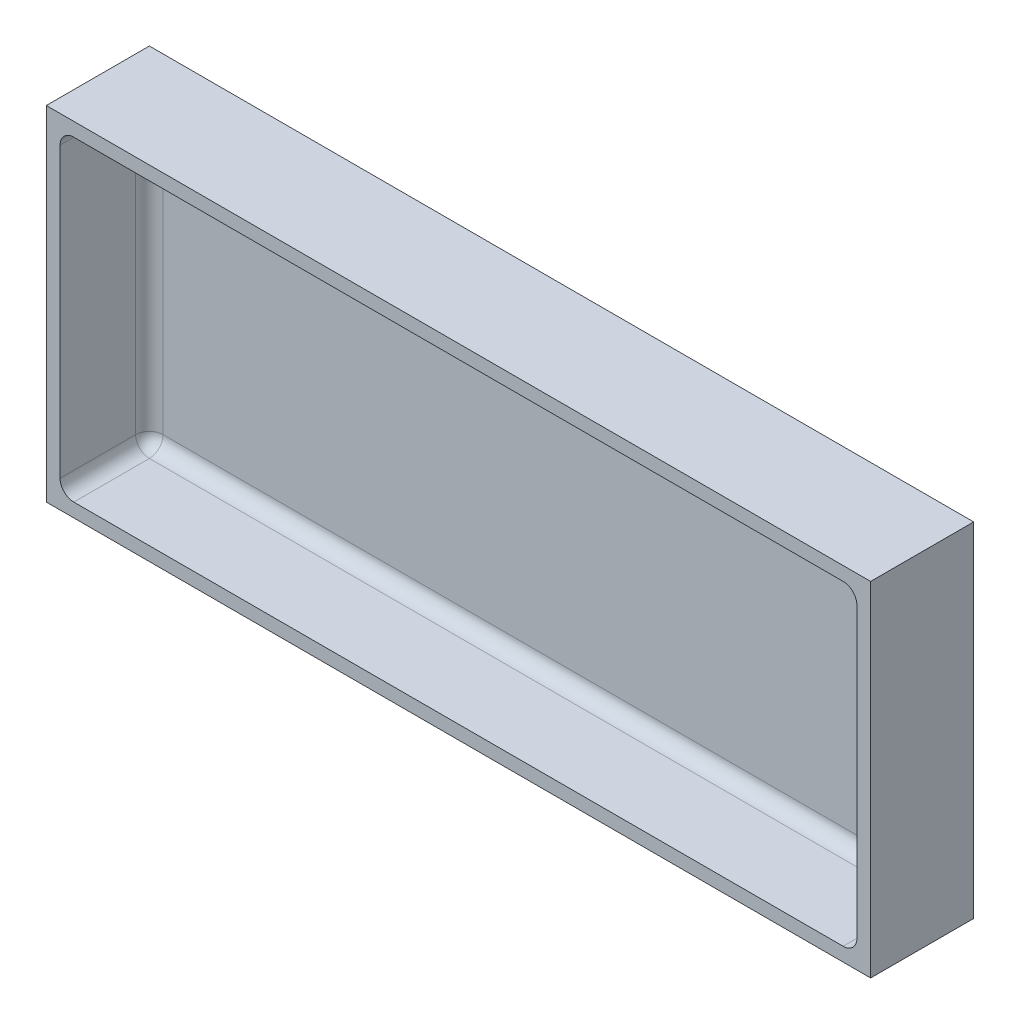
from build123d import *

# Parameters (mm, degrees)
SKETCH1_W           = 120
SKETCH1_H           = 50
BOSS_EXTRUDE1_DEPTH = 15
SHELL1_T            = -2
FILLET1_R           = 2


with BuildPart() as part:
    # Sketch1 → Boss-Extrude1 (new body)
    with BuildSketch(Plane.XY):
        Rectangle(SKETCH1_W, SKETCH1_H)
    extrude(amount=-BOSS_EXTRUDE1_DEPTH)

    # Shell1
    shell1_openings = [part.faces().sort_by_distance(p)[0] for p in [
        (0, 0, 0),
    ]]
    offset(amount=SHELL1_T, openings=shell1_openings, kind=Kind.INTERSECTION)

    # Fillet1
    fillet1_edges = [part.edges().sort_by_distance(p)[0] for p in [
        (-58, 23, -6.5),
        (-58, -23, -6.5),
        (0, -23, -13),
        (-58, 0, -13),
        (0, 23, -13),
        (58, 0, -13),
        (58, 23, -6.5),
        (58, -23, -6.5),
    ]]
    fillet(fillet1_edges, radius=FILLET1_R)


solid = part.part
